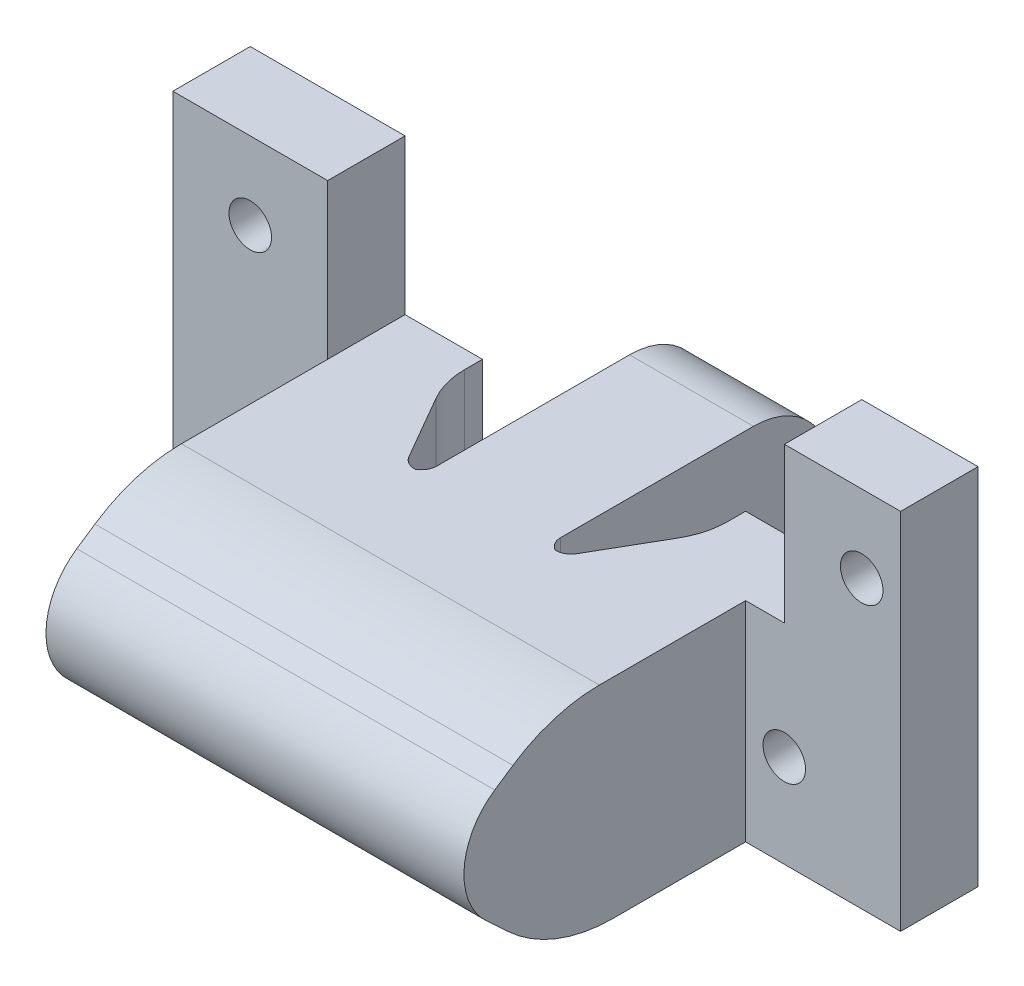
from build123d import *
from OCP.BRepFilletAPI import BRepFilletAPI_MakeChamfer

# Parameters (mm, degrees)
SKETCH2_R             = 2.75
BOSS_EXTRUDE1_DEPTH   = 10
BOSS_EXTRUDE1_2_DEPTH = 10
SKETCH3_W             = 10
SKETCH3_H             = 27
BOSS_EXTRUDE2_DEPTH   = 15
SKETCH4_W             = 54
SKETCH4_H             = 27
BOSS_EXTRUDE3_DEPTH   = 10
CHAMFER1_SIZE         = 20
CHAMFER1_SIZE2        = 11.547005384
FILLET1_R             = 10
BOSS_EXTRUDE4_DEPTH   = 54
FILLET2_R             = 20
BOSS_EXTRUDE5_DEPTH   = 27
FILLET3_R             = 10
SKETCH7_R             = 4
BOSS_EXTRUDE6_DEPTH   = 27
FILLET4_R             = 2


with BuildPart() as part:
    # Sketch2 → Boss-Extrude1 (new body)
    with BuildSketch(Plane.XY):
        Polygon((44, -75), (44, -102), (74.026339821, -102), (74.026339821, -55), (59.01316991, -55), (59, -75), align=None)
        with Locations((59, -90)):
            Circle(SKETCH2_R, mode=Mode.SUBTRACT)
        with Locations((69, -65)):
            Circle(SKETCH2_R, mode=Mode.SUBTRACT)
    extrude(amount=BOSS_EXTRUDE1_DEPTH)



with BuildPart() as body_2:
    # Sketch2 → Boss-Extrude1 2 (new body)
    with BuildSketch(Plane.XY):
        Polygon((-20, -55), (-20, -102), (10, -102), (10, -75), (0, -75), (0, -55), align=None)
        with Locations((-10, -65)):
            Circle(SKETCH2_R, mode=Mode.SUBTRACT)
        with Locations((-5, -90)):
            Circle(SKETCH2_R, mode=Mode.SUBTRACT)
    extrude(amount=BOSS_EXTRUDE1_2_DEPTH)


with BuildPart() as part_1:
    add(part.part)

    add(body_2.part)  # Boss-Extrude2 merges body 2
    # Sketch3 → Boss-Extrude2 (add)
    with BuildSketch(Plane.XY.offset(10)):
        with Locations((5, -88.5)):
            Rectangle(SKETCH3_W, SKETCH3_H)
        with Locations((49, -88.5)):
            Rectangle(SKETCH3_W, SKETCH3_H)
    extrude(amount=BOSS_EXTRUDE2_DEPTH)

    # Sketch4 → Boss-Extrude3 (add)
    with BuildSketch(Plane.XY.offset(25)):
        with Locations((27, -88.5)):
            Rectangle(SKETCH4_W, SKETCH4_H)
    extrude(amount=BOSS_EXTRUDE3_DEPTH)

    # Chamfer1: one chamfer whose edges measure the first distance from different faces: ONE call of the kernel's chamfer builder (chamfer() names one face for all edges)
    chamfer1_edges_1 = [part_1.edges().sort_by_distance(p)[0] for p in [
        (44, -88.5, 25),
    ]]
    chamfer1_side_1 = [part_1.faces().sort_by_distance(p)[0] for p in [
        (44, -88.5, 12.5),
    ]]
    chamfer1_edges_2 = [part_1.edges().sort_by_distance(p)[0] for p in [
        (10, -88.5, 25),
    ]]
    chamfer1_side_2 = [part_1.faces().sort_by_distance(p)[0] for p in [
        (10, -88.5, 12.5),
    ]]
    chamfer1 = BRepFilletAPI_MakeChamfer(part_1.part.solid().wrapped)
    for e in chamfer1_edges_1:
        chamfer1.Add(CHAMFER1_SIZE, CHAMFER1_SIZE2, e.wrapped, chamfer1_side_1[0].wrapped)  # the first distance lies on this face
    for e in chamfer1_edges_2:
        chamfer1.Add(CHAMFER1_SIZE, CHAMFER1_SIZE2, e.wrapped, chamfer1_side_2[0].wrapped)  # the first distance lies on this face
    add(Compound.cast(chamfer1.Shape()), mode=Mode.REPLACE)

    # Fillet1
    # the kernel refuses this fillet: 10 mm, written as the material it adds along each edge
    with BuildSketch(Plane(origin=(44, -102, 5), x_dir=(0, 0, -1), z_dir=(0, 1, 0))) as fillet1_piece_1:
        with BuildLine():
            CenterArc((FILLET1_R * 0.267949192431, FILLET1_R), FILLET1_R, 240, 30)
            Line((-FILLET1_R * 0.232050807569, FILLET1_R * 0.133974596216), (0, 0))
            Line((0, 0), (FILLET1_R * 0.267949192431, 0))
        make_face()
    extrude(amount=27)
    with BuildSketch(Plane(origin=(10, -102, 5), x_dir=(0, 0, -1), z_dir=(0, 1, 0))) as fillet1_piece_2:
        with BuildLine():
            CenterArc((FILLET1_R * 0.267949192431, -FILLET1_R), FILLET1_R, 90, 30)
            Line((-FILLET1_R * 0.232050807569, -FILLET1_R * 0.133974596216), (0, 0))
            Line((0, 0), (FILLET1_R * 0.267949192431, 0))
        make_face()
    extrude(amount=27)
    with BuildSketch(Plane(origin=(21.547005384, -102, 25), x_dir=(-0.500000000000001, 0, -0.866025403784438), z_dir=(0, 1, 0))) as fillet1_piece_3:
        with BuildLine():
            CenterArc((FILLET1_R * 0.57735026919, -FILLET1_R), FILLET1_R, 90, 60)
            Line((-FILLET1_R * 0.288675134595, -FILLET1_R * 0.5), (0, 0))
            Line((0, 0), (FILLET1_R * 0.57735026919, 0))
        make_face()
    extrude(amount=27)
    with BuildSketch(Plane(origin=(32.452994616, -102, 25), x_dir=(0.5000000000000013, 0, -0.866025403784438), z_dir=(0, 1, 0))) as fillet1_piece_4:
        with BuildLine():
            CenterArc((FILLET1_R * 0.57735026919, FILLET1_R), FILLET1_R, 210, 60)
            Line((-FILLET1_R * 0.288675134595, FILLET1_R * 0.5), (0, 0))
            Line((0, 0), (FILLET1_R * 0.57735026919, 0))
        make_face()
    extrude(amount=27)

    # Sketch5 → Boss-Extrude4 (add)
    with BuildSketch(Plane.ZY):
        with BuildLine():
            ThreePointArc((35, -78.77790147), (38.839091833, -78.571636186), (42.413977278, -79.986332451))
            Line((42.413977278, -79.986332451), (35, -75))
            Line((35, -75), (35, -78.77790147))
        make_face()
        with BuildLine():
            ThreePointArc((35, -96.130929705), (39.540098119, -96.194122408), (43.533263146, -94.032845631))
            ThreePointArc((43.533263146, -94.032845631), (45.645892631, -91.040634418), (46.39125548, -87.454415588))
            ThreePointArc((46.39125548, -87.454415588), (45.334947826, -83.223842115), (42.413977278, -79.986332451))
            ThreePointArc((42.413977278, -79.986332451), (38.839091833, -78.571636186), (35, -78.77790147))
            Line((35, -78.77790147), (35, -96.130929705))
        make_face()
        with BuildLine():
            ThreePointArc((35, -78.77790147), (28.39125548, -87.454415588), (35, -96.130929705))
            Line((35, -96.130929705), (35, -78.77790147))
        make_face()
        with BuildLine():
            Line((35, -102), (43.533263146, -94.032845631))
            ThreePointArc((43.533263146, -94.032845631), (39.540098119, -96.194122408), (35, -96.130929705))
            Line((35, -96.130929705), (35, -102))
        make_face()
    extrude(amount=-BOSS_EXTRUDE4_DEPTH)

    # Fillet2
    fillet2_edges = [part_1.edges().sort_by_distance(p)[0] for p in [
        (27, -102, 35),
        (27, -75, 35),
    ]]
    fillet(fillet2_edges, radius=FILLET2_R)

    # Sketch6 → Boss-Extrude5 (add)
    with BuildSketch(Plane.XZ.offset(102)):
        with BuildLine():
            Line((27, -20.005137591), (27, 24.994862409))
            ThreePointArc((27, 24.994862409), (22.461220804, 23.739984394), (19, 20.546994264))
            Line((19, 20.546994264), (19, -20.005137591))
            Line((19, -20.005137591), (27, -20.005137591))
        make_face()
        with BuildLine():
            ThreePointArc((35, 20.546994264), (31.538779196, 23.739984394), (27, 24.994862409))
            Line((27, 24.994862409), (27, -20.005137591))
            Line((27, -20.005137591), (35, -20.005137591))
            Line((35, -20.005137591), (35, 20.546994264))
        make_face()
    extrude(amount=-BOSS_EXTRUDE5_DEPTH)

    # Fillet3
    fillet3_edges = [part_1.edges().sort_by_distance(p)[0] for p in [
        (27, -102, -20.005137591),
        (27, -75, -20.005137591),
    ]]
    fillet(fillet3_edges, radius=FILLET3_R)

    # Sketch7 → Boss-Extrude6 (add)
    with BuildSketch(Plane.XZ.offset(102)):
        with Locations((35, 20.546994264)):
            Circle(SKETCH7_R)
        with Locations((19, 20.546994264)):
            Circle(SKETCH7_R)
    extrude(amount=-BOSS_EXTRUDE6_DEPTH)

    # Fillet4
    # the kernel refuses this fillet: 2 mm, written as the material it adds along each edge
    with BuildSketch(Plane(origin=(19, -75, 16.546994264), x_dir=(-0.9855985596534884, 0, 0.16910197872576482), z_dir=(0, -1, 0))) as fillet4_piece_1:
        with BuildLine():
            CenterArc((1.691019787, 1.971197119), FILLET4_R, 189.735610317, 70.528779366)
            Line((-0.280177332, 1.632993162), (0, 0))
            ThreePointArc((0, 0), (0.676407915, 0.057605761), (1.35281583, 0))
        make_face()
    extrude(amount=27)
    with BuildSketch(Plane(origin=(16.982072855, -75, 17.093304927), x_dir=(0.9365633993502674, 0, -0.35049821539841175), z_dir=(0, -1, 0))) as fillet4_piece_2:
        with BuildLine():
            CenterArc((1.698511894, -1.970939444), FILLET4_R, 99.779167009, 70.738624206)
            Line((-0.274161714, -1.641456762), (0, 0))
            ThreePointArc((0, 0), (0.679404758, -0.058121111), (1.358809515, 0))
        make_face()
    extrude(amount=27)
    with BuildSketch(Plane(origin=(37.017927145, -75, 17.093304927), x_dir=(0.5000000000000021, 0, -0.8660254037844376), z_dir=(0, -1, 0))) as fillet4_piece_3:
        with BuildLine():
            CenterArc((1.664194985, -2), FILLET4_R, 90, 70.738624206)
            ThreePointArc((-0.223852102, -1.340243834), (-0.05459906, -0.679696867), (0, 0))
            Line((0, 0), (1.664194985, 0))
        make_face()
    extrude(amount=27)
    with BuildSketch(Plane(origin=(35, -75, 16.546994264), x_dir=(0, 0, -1), z_dir=(0, -1, 0))) as fillet4_piece_4:
        with BuildLine():
            CenterArc((1.656854249, 2), FILLET4_R, 199.471220634, 70.528779366)
            ThreePointArc((-0.228763834, 1.333333333), (-0.057605761, 0.676407915), (0, 0))
            Line((0, 0), (1.656854249, 0))
        make_face()
    extrude(amount=27)


solid = part_1.part
